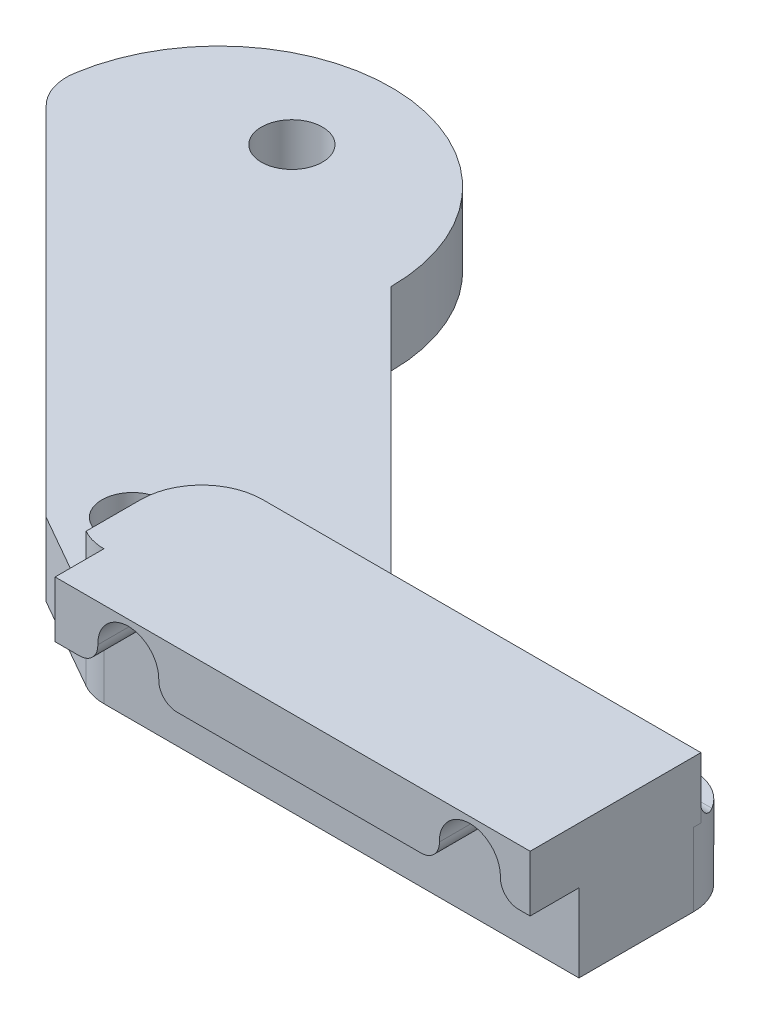
from build123d import *

# Parameters (mm, degrees)
SKETCH1_R           = 3.175
BOSS_EXTRUDE1_DEPTH = 3.81
FILLET1_R           = 5.08
SKETCH3_R           = 3.175
CUT_EXTRUDE2_DEPTH  = 78.809401293
BOSS_EXTRUDE2_START = 6.35
BOSS_EXTRUDE2_DEPTH = 6.35
SKETCH6_R           = 2.286
CUT_EXTRUDE3_DEPTH  = 6.35
BOSS_EXTRUDE3_DEPTH = 5.08
FILLET2_R           = 1.905
FILLET3_R           = 1.905


with BuildPart() as part:
    # Sketch1 → Boss-Extrude1 (new, symmetric)
    with BuildSketch(Plane(origin=(0, 0, 0), x_dir=(1, 0, 0), z_dir=(0, 1, 0))):
        with BuildLine():
            Line((-43.270256121, 34.29), (-4.490128061, -4.490128061))
            Line((-4.490128061, -4.490128061), (6.35, -10.668))
            Line((6.35, -10.668), (57.15, -10.668))
            Line((57.15, -10.668), (57.15, 6.35))
            Line((57.15, 6.35), (20.590768363, 6.35))
            Line((20.590768363, 6.35), (-7.349231637, 34.29))
            ThreePointArc((-7.349231637, 34.29), (-25.309743879, 52.250512242), (-43.270256121, 34.29))
        make_face()
        Circle(SKETCH1_R, mode=Mode.SUBTRACT)
    extrude(amount=BOSS_EXTRUDE1_DEPTH, both=True)

    # Fillet1
    fillet1_edges = [part.edges().sort_by_distance(p)[0] for p in [
        (57.15, 0, -6.35),
        (20.590768363, 0, -6.35),
        (6.35, 0, 10.668),
        (-43.270256121, 0, -34.29),
    ]]
    fillet(fillet1_edges, radius=FILLET1_R)

    # Sketch3 → Cut-Extrude2 (cut, through all)
    with BuildSketch(Plane(origin=(0, 3.81, 0), x_dir=(1, 0, 0), z_dir=(0, 1, 0))):
        with Locations((-25.309743879, 41.91)):
            Circle(SKETCH3_R)
    extrude(amount=-CUT_EXTRUDE2_DEPTH, mode=Mode.SUBTRACT)

    # Sketch4 → Boss-Extrude2 (add)
    with BuildSketch(Plane(origin=(0, 3.81, 0), x_dir=(1, 0, 0), z_dir=(0, 1, 0)).offset(BOSS_EXTRUDE2_START)):
        with BuildLine():
            Line((57.15, -10.668), (7.695948183, -10.668))
            ThreePointArc((7.695948183, -10.668), (6.394891779, -10.498565368), (5.180624356, -10.001563871))
            Line((5.180624356, -10.001563871), (5.180624356, -4.318))
            ThreePointArc((5.180624356, -4.318), (7.040496295, 0.172128061), (11.530624356, 2.032))
            Line((11.530624356, 2.032), (57.15, 2.032))
            Line((57.15, 2.032), (57.15, -10.668))
        make_face()
    extrude(amount=-BOSS_EXTRUDE2_DEPTH)

    # Sketch6 → Cut-Extrude3 (cut)
    with BuildSketch(Plane.XY.offset(10.668)):
        with Locations((15.315948183, 6.35)):
            Circle(SKETCH6_R)
        with Locations((50.875948183, 6.35)):
            Circle(SKETCH6_R)
    extrude(amount=-CUT_EXTRUDE3_DEPTH, mode=Mode.SUBTRACT)

    # Sketch7 → Boss-Extrude3 (add)
    with BuildSketch(Plane.XY.offset(10.668)):
        with BuildLine():
            Line((57.15, 10.16), (7.695948183, 10.16))
            Line((7.695948183, 10.16), (7.695948183, 4.318))
            Line((7.695948183, 4.318), (12.876357848, 4.318))
            ThreePointArc((12.876357848, 4.318), (14.235456237, 9.335491945), (18.490948183, 6.35))
            ThreePointArc((18.490948183, 6.35), (18.301440128, 5.269508055), (17.755538517, 4.318))
            Line((17.755538517, 4.318), (48.436357848, 4.318))
            ThreePointArc((48.436357848, 4.318), (49.795456237, 9.335491945), (54.050948183, 6.35))
            ThreePointArc((54.050948183, 6.35), (53.861440128, 5.269508055), (53.315538517, 4.318))
            Line((53.315538517, 4.318), (57.15, 4.318))
            Line((57.15, 4.318), (57.15, 10.16))
        make_face()
    extrude(amount=BOSS_EXTRUDE3_DEPTH)

    # Fillet2
    fillet2_edges = [part.edges().sort_by_distance(p)[0] for p in [
        (53.315538517, 4.318, 13.208),
        (48.436357848, 4.318, 13.208),
        (17.755538517, 4.318, 13.208),
        (12.876357848, 4.318, 13.208),
    ]]
    fillet(fillet2_edges, radius=FILLET2_R)

    # Fillet3
    fillet3_edges = [part.edges().sort_by_distance(p)[0] for p in [
        (5.180624356, 3.81, 7.159781936),
        (7.040496295, 3.81, -0.172128061),
        (34.31157461, 3.81, -2.032),
    ]]
    fillet(fillet3_edges, radius=FILLET3_R)


solid = part.part
